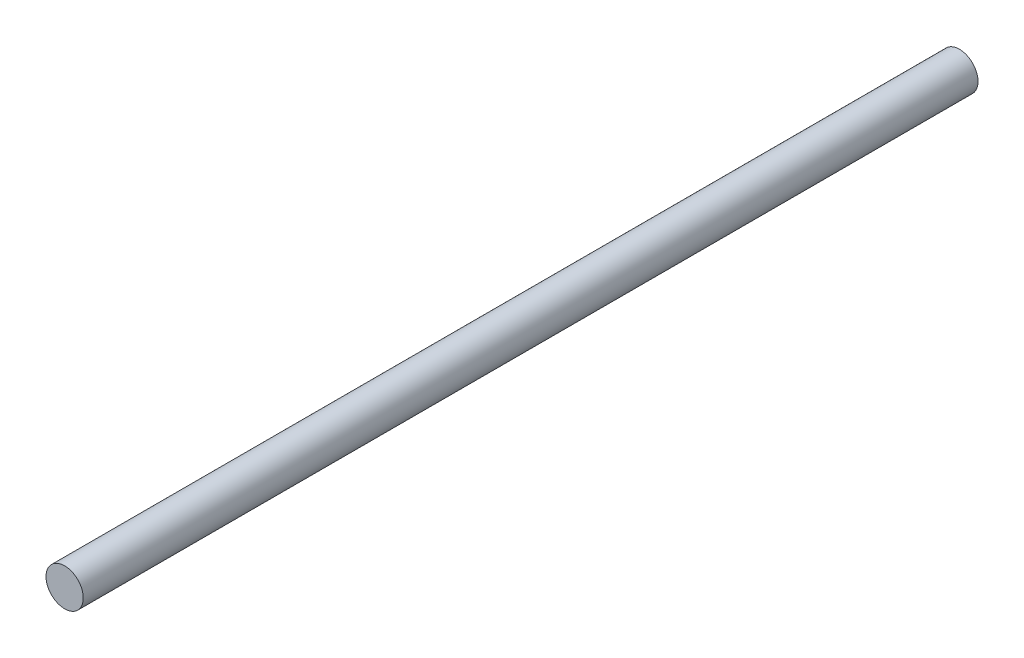
from build123d import *

# Parameters (mm, degrees)
SKETCH1_R           = 3.175
BOSS_EXTRUDE1_DEPTH = 152.4


with BuildPart() as part:
    # Sketch1 → Boss-Extrude1 (new body)
    with BuildSketch(Plane.XY):
        Circle(SKETCH1_R)
    extrude(amount=BOSS_EXTRUDE1_DEPTH)


solid = part.part
